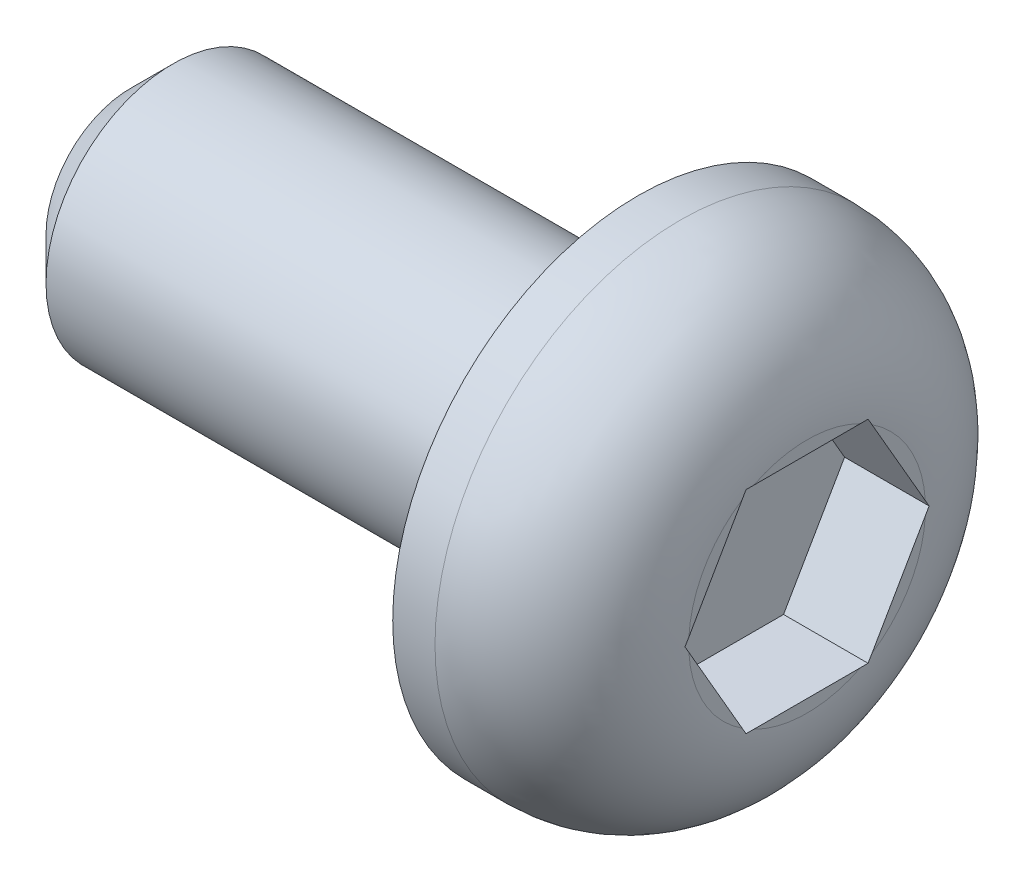
from build123d import *

# Parameters (mm, degrees)
CUT_EXTRUDE1_DEPTH = 1
FILLET1_R          = 1.5
CHAMFER1_SIZE      = 0.5


with BuildPart() as part:
    # Sketch1 → Revolve1 (revolve)
    with BuildSketch(Plane(origin=(0, 0, 0), x_dir=(1, 0, 0), z_dir=(0, 1, 0))):
        Polygon((0, 0), (-6, -7.3e-16), (-6, -1.5000000000000007), (1e-17, -1.5), align=None)
        Polygon((1e-17, 1.3999999999999995), (1e-17, 0), (1e-17, -1.5), (2, -1.5), (2, 1.3999999999999995), align=None)
    revolve(axis=Axis((1e-17, 0, 1.5), (-1, 0, 1.1e-16)))

    # Sketch3 → Cut-Extrude1 (cut)
    with BuildSketch(Plane(origin=(2, 0, -2.2e-16), x_dir=(-1.3e-16, 0, -1), z_dir=(1, 0, -1.3e-16))):
        Polygon((-2.2216878364870323, -1.2500000000000002), (-0.7783121635129678, -1.2500000000000002), (-0.05662432702593554, 0), (-0.7783121635129678, 1.2500000000000002), (-2.2216878364870323, 1.2500000000000004), (-2.9433756729740645, 0), align=None)
    extrude(amount=-CUT_EXTRUDE1_DEPTH, mode=Mode.SUBTRACT)

    # Fillet1
    fillet1_edges = [part.edges().sort_by_distance(p)[0] for p in [
        (2.000000000000001, -3.6e-16, 4.3999999999999995),
    ]]
    fillet(fillet1_edges, radius=FILLET1_R - 0.0001)  # a hair under: the kernel refuses the full size

    # Chamfer1
    chamfer1_edges = [part.edges().sort_by_distance(p)[0] for p in [
        (-6, -1.8e-16, 3.000000000000001),
    ]]
    chamfer(chamfer1_edges, length=CHAMFER1_SIZE)


solid = part.part
